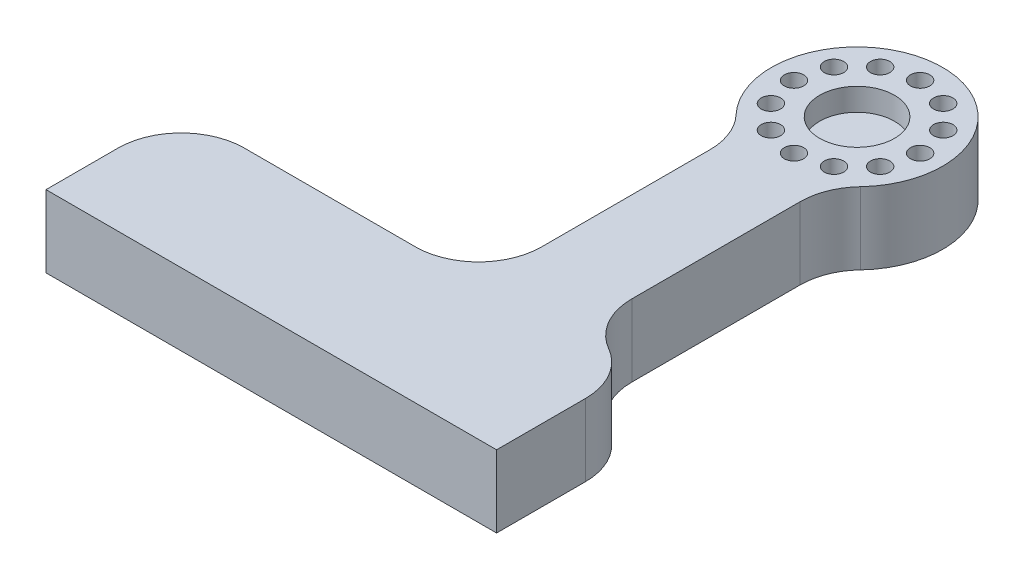
from build123d import *

# Parameters (mm, degrees)
SKETCH1_R           = 1.075
SKETCH1_W           = 50
SKETCH1_H           = 15
BOSS_EXTRUDE1_DEPTH = 8
SKETCH2_R           = 4.15
CUT_EXTRUDE1_DEPTH  = 2.5
FILLET1_R           = 7
FILLET2_R           = 7
FILLET3_R           = 7
FILLET4_R           = 7
FILLET5_R           = 7


with BuildPart() as part:
    # Sketch1 → Boss-Extrude1 (new body)
    # profile 1 of 4: a face of its own
    with BuildSketch(Plane(origin=(0, 0, 0), x_dir=(1, 0, 0), z_dir=(0, 1, 0))):
        with BuildLine():
            Line((-5, -8.077747211), (-5, -37))
            Line((-5, -37), (5, -37))
            Line((5, -37), (5, -8.077747211))
            ThreePointArc((5, -8.077747211), (0, -9.5), (-5, -8.077747211))
        make_face()
    # profile 2 of 4: a face of its own
    with BuildSketch(Plane(origin=(0, 0, 0), x_dir=(1, 0, 0), z_dir=(0, 1, 0))):
        with BuildLine():
            Line((-5, -3.665539315), (-5, -8.077747211))
            ThreePointArc((-5, -8.077747211), (0, -9.5), (5, -8.077747211))
            Line((5, -8.077747211), (5, -3.665539315))
            ThreePointArc((5, -3.665539315), (4.987177826, -3.5), (5, -3.334460685))
            Line((5, -3.334460685), (5, 0))
            Line((5, 0), (-5, 0))
            Line((-5, 0), (-5, -3.334460685))
            ThreePointArc((-5, -3.334460685), (-4.990388163, -3.416982422), (-4.987177826, -3.5))
            ThreePointArc((-4.987177826, -3.5), (-4.990388163, -3.583017578), (-5, -3.665539315))
        make_face()
        with Locations(Location((-3.5, -6.062177826, 0), (0, 0, 270))):
            Circle(SKETCH1_R, mode=Mode.SUBTRACT)
        with Locations(Location((0, -7, 0), (0, 0, 270))):
            Circle(SKETCH1_R, mode=Mode.SUBTRACT)
        with Locations(Location((3.5, -6.062177826, 0), (0, 0, 270))):
            Circle(SKETCH1_R, mode=Mode.SUBTRACT)
    # profile 3 of 4: a face of its own
    with BuildSketch(Plane(origin=(0, 0, 0), x_dir=(1, 0, 0), z_dir=(0, 1, 0))):
        with BuildLine():
            ThreePointArc((9.5, 0), (-4.623310502, 8.299096336), (-5, -8.077747211))
            Line((-5, -8.077747211), (-5, -3.665539315))
            ThreePointArc((-5, -3.665539315), (-7.137177826, -3.5), (-5, -3.334460685))
            Line((-5, -3.334460685), (-5, 0))
            Line((-5, 0), (5, 0))
            Line((5, 0), (5, -3.334460685))
            ThreePointArc((5, -3.334460685), (6.145195405, -2.428210337), (7.137177826, -3.5))
            ThreePointArc((7.137177826, -3.5), (6.145195405, -4.571789663), (5, -3.665539315))
            Line((5, -3.665539315), (5, -8.077747211))
            ThreePointArc((5, -8.077747211), (8.299096336, -4.623310502), (9.5, 0))
        make_face()
        with Locations(Location((-7, 0, 0), (0, 0, 270))):
            Circle(SKETCH1_R, mode=Mode.SUBTRACT)
        with Locations(Location((-6.062177826, 3.5, 0), (0, 0, 270))):
            Circle(SKETCH1_R, mode=Mode.SUBTRACT)
        with Locations(Location((-3.5, 6.062177826, 0), (0, 0, 270))):
            Circle(SKETCH1_R, mode=Mode.SUBTRACT)
        with Locations(Location((7, 0, 0), (0, 0, 270))):
            Circle(SKETCH1_R, mode=Mode.SUBTRACT)
        with Locations(Location((0, 7, 0), (0, 0, 270))):
            Circle(SKETCH1_R, mode=Mode.SUBTRACT)
        with Locations(Location((3.5, 6.062177826, 0), (0, 0, 270))):
            Circle(SKETCH1_R, mode=Mode.SUBTRACT)
        with Locations(Location((6.062177826, 3.5, 0), (0, 0, 270))):
            Circle(SKETCH1_R, mode=Mode.SUBTRACT)
    # profile 4 of 4: a face of its own
    with BuildSketch(Plane(origin=(0, 0, 0), x_dir=(1, 0, 0), z_dir=(0, 1, 0))):
        with Locations((-13, -44.5)):
            Rectangle(SKETCH1_W, SKETCH1_H)
    extrude(amount=BOSS_EXTRUDE1_DEPTH)

    # Sketch2 → Cut-Extrude1 (cut)
    with BuildSketch(Plane(origin=(0, 8, 0), x_dir=(1, 0, 0), z_dir=(0, 1, 0))):
        with Locations(Location((0, 0, 0), (0, 0, 270))):
            Circle(SKETCH2_R)
    extrude(amount=-CUT_EXTRUDE1_DEPTH, mode=Mode.SUBTRACT)

    # Fillet1
    fillet1_edges = [part.edges().sort_by_distance(p)[0] for p in [
        (5, 4, 37),
    ]]
    fillet(fillet1_edges, radius=FILLET1_R - 0.0001)  # a hair under: the kernel refuses the full size

    # Fillet2
    fillet2_edges = [part.edges().sort_by_distance(p)[0] for p in [
        (-5, 4, 37),
    ]]
    fillet(fillet2_edges, radius=FILLET2_R)

    # Fillet3
    fillet3_edges = [part.edges().sort_by_distance(p)[0] for p in [
        (-5, 4, 8.077747211),
        (5, 4, 8.077747211),
    ]]
    fillet(fillet3_edges, radius=FILLET3_R)

    # Fillet4
    fillet4_edges = [part.edges().sort_by_distance(p)[0] for p in [
        (12, 4, 37),
    ]]
    fillet(fillet4_edges, radius=FILLET4_R)

    # Fillet5
    fillet5_edges = [part.edges().sort_by_distance(p)[0] for p in [
        (-38, 4, 37),
    ]]
    fillet(fillet5_edges, radius=FILLET5_R)


solid = part.part
